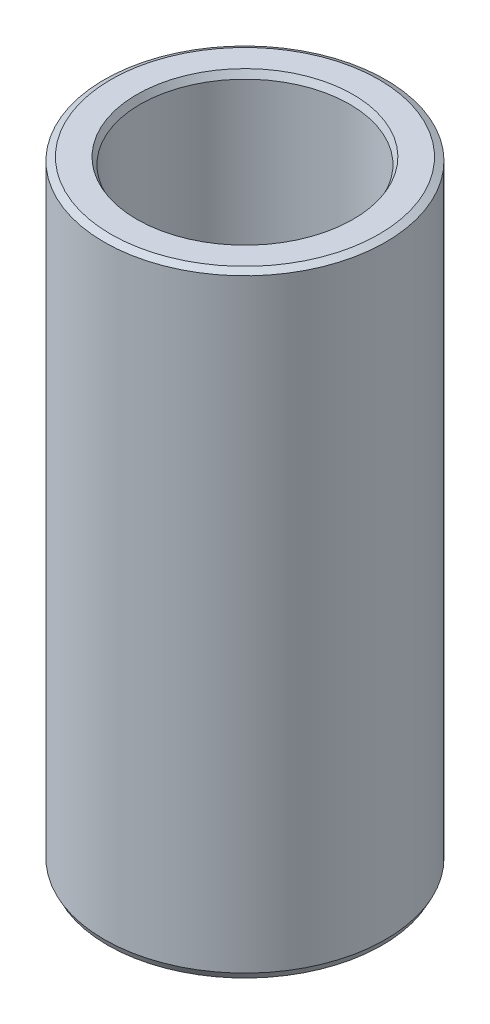
from build123d import *
from OCP.BRepFilletAPI import BRepFilletAPI_MakeChamfer

# Parameters (mm, degrees)
SKETCH1_R           = 60
BOSS_EXTRUDE1_DEPTH = 261.781373721
SKETCH2_R           = 44.633734975
CUT_EXTRUDE1_DEPTH  = 276.189911929
CHAMFER1_SIZE       = 1.475412667
CHAMFER1_SIZE2      = 2.856276031


with BuildPart() as part:
    # Sketch1 → Boss-Extrude1 (new body)
    with BuildSketch(Plane(origin=(0, 0, 0), x_dir=(1, 0, 0), z_dir=(0, 1, 0))):
        Circle(SKETCH1_R)
    extrude(amount=BOSS_EXTRUDE1_DEPTH)

    # Sketch2 → Cut-Extrude1 (cut, through all)
    with BuildSketch(Plane(origin=(0, 0, 0), x_dir=(1, 0, 0), z_dir=(0, 1, 0))):
        Circle(SKETCH2_R)
    extrude(amount=CUT_EXTRUDE1_DEPTH, mode=Mode.SUBTRACT)

    # Chamfer1: one chamfer whose edges measure the first distance from different faces: ONE call of the kernel's chamfer builder (chamfer() names one face for all edges)
    chamfer1_edges_1 = [part.edges().sort_by_distance(p)[0] for p in [
        (-44.633734975, 261.781373721, 0),
    ]]
    chamfer1_side_1 = [part.faces().sort_by_distance(p)[0] for p in [
        (-58.302943725, 261.781373721, 0),
    ]]
    chamfer1_edges_2 = [part.edges().sort_by_distance(p)[0] for p in [
        (-44.633734975, 0, 0),
    ]]
    chamfer1_side_2 = [part.faces().sort_by_distance(p)[0] for p in [
        (-44.633734975, 130.89068686, 0),
    ]]
    chamfer1_edges_3 = [part.edges().sort_by_distance(p)[0] for p in [
        (-60, 0, 0),
    ]]
    chamfer1_side_3 = [part.faces().sort_by_distance(p)[0] for p in [
        (-58.302943725, 0, 0),
    ]]
    chamfer1_edges_4 = [part.edges().sort_by_distance(p)[0] for p in [
        (-60, 261.781373721, 0),
    ]]
    chamfer1_side_4 = [part.faces().sort_by_distance(p)[0] for p in [
        (-60, 130.89068686, 0),
    ]]
    chamfer1 = BRepFilletAPI_MakeChamfer(part.part.solid().wrapped)
    for e in chamfer1_edges_1:
        chamfer1.Add(CHAMFER1_SIZE, CHAMFER1_SIZE2, e.wrapped, chamfer1_side_1[0].wrapped)  # the first distance lies on this face
    for e in chamfer1_edges_2:
        chamfer1.Add(CHAMFER1_SIZE, CHAMFER1_SIZE2, e.wrapped, chamfer1_side_2[0].wrapped)  # the first distance lies on this face
    for e in chamfer1_edges_3:
        chamfer1.Add(CHAMFER1_SIZE, CHAMFER1_SIZE2, e.wrapped, chamfer1_side_3[0].wrapped)  # the first distance lies on this face
    for e in chamfer1_edges_4:
        chamfer1.Add(CHAMFER1_SIZE, CHAMFER1_SIZE2, e.wrapped, chamfer1_side_4[0].wrapped)  # the first distance lies on this face
    add(Compound.cast(chamfer1.Shape()), mode=Mode.REPLACE)


solid = part.part
